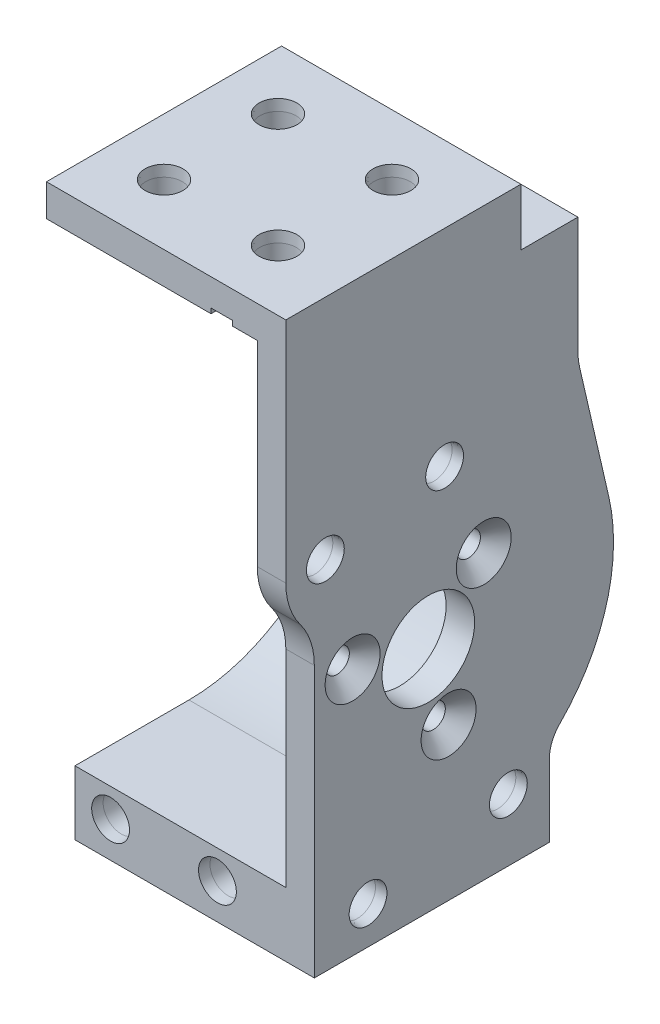
from build123d import *

# Parameters (mm, degrees)
MOTOR_SHELL_DEPTH                   = 33.6
MOTOR_MOUNT_DEPTH                   = 4
MOUNTING_HOLE_D                     = 3.4
MOUNTING_HOLE_CSINK_D               = 7.72
MOUNTING_HOLE_CSINK_ANGLE           = 90
HOLE_DUPLICATION_COUNT              = 3
SKETCH11_R                          = 6.5
SHAFT_BASE_CUTOUT_DEPTH             = 66.612193989
CSK_FOR_M3_INSERT_SFHCS1_AT_2_COUNT = 2
CSK_FOR_M3_INSERT_SFHCS1_AT_2_PITCH = 20
CSK_FOR_M3_INSERT_SFHCS1_AT_3_COUNT = 2
CSK_FOR_M3_INSERT_SFHCS1_AT_3_PITCH = 45.233529346
CSK_FOR_M3_INSERT_SFHCS1_AT_4_COUNT = 2
CSK_FOR_M3_INSERT_SFHCS1_AT_4_PITCH = 48.980637063
CSK_FOR_M3_INSERT_SFHCS2_AT_2_COUNT = 2
CSK_FOR_M3_INSERT_SFHCS2_AT_2_PITCH = 16
CSK_FOR_M3_INSERT_SFHCS2_AT_3_COUNT = 2
CSK_FOR_M3_INSERT_SFHCS2_AT_3_PITCH = 22.627416998
CSK_FOR_M3_INSERT_SFHCS2_AT_4_COUNT = 2
CSK_FOR_M3_INSERT_SFHCS2_AT_4_PITCH = 16
CSK_FOR_M3_INSERT_SFHCS3_AT_2_COUNT = 2
CSK_FOR_M3_INSERT_SFHCS3_AT_2_PITCH = 15
ENLARGE_CAVITY_DEPTH                = 29.6
MOD_1_DEPTH                         = 29.6
SKETCH31_W                          = 8
SKETCH31_H                          = 8
MOD_2_DEPTH                         = 33.6
SKETCH36_W                          = 3
SKETCH36_H                          = 0.7
CUT_EXTRUDE1_DEPTH                  = 23
M4_CLEARANCE_HOLE1_D                = 4.5
M4_CLEARANCE_HOLE1_DEPTH            = 6
M4_CLEARANCE_HOLE1_TIP              = 1.351936393
INSERT_START                        = 45.5
INSERT_CLEARANCES_OUTLINE_R         = 1.8
INSERT_CLEARANCES_DEPTH             = 0.7
INSERT_START_2                      = 29.6
INSERT_CLEARANCES_2_OUTLINE_R       = 1.8
INSERT_CLEARANCES_2_DEPTH           = 0.2
INSERT_CLEARANCES_5_OUTLINE_W       = 1.724765775
INSERT_CLEARANCES_5_OUTLINE_H       = 2.045205283
INSERT_CLEARANCES_8_OUTLINE_W       = 1.724765775
INSERT_CLEARANCES_8_OUTLINE_H       = 2.045205283
FILLET1_R                           = 10


# Read off the part's stored shape, not the designer's step: Insert clearances
with BuildPart() as part:
    # Motor Shell Profile → Motor Shell (new body)
    with BuildSketch(Plane(origin=(0, 0, 0), x_dir=(0, 0, -1), z_dir=(1, 0, 0))):
        with BuildLine():
            Line((25.336282685, 5.837189366), (21.25527589, 23.550772962))
            ThreePointArc((21.25527589, 23.550772962), (21.064023926, 24.66607615), (21, 25.795845795))
            Line((21, 25.795845795), (21, 50))
            Line((21, 50), (-20, 50))
            Line((-20, 50), (-20, 45.5))
            Line((-20, 45.5), (10.9, 45.5))
            ThreePointArc((10.9, 45.5), (12.314213562, 44.914213562), (12.9, 43.5))
            Line((12.9, 43.5), (12.9, 42))
            Line((12.9, 42), (21.438393041, 4.939160233))
            ThreePointArc((21.438393041, 4.939160233), (17.214260442, -13.699242221), (0, -22))
            Line((0, -22), (-16, -22))
            Line((-16, -22), (-16, -32))
            Line((-16, -32), (17, -32))
            Line((17, -32), (17, -21.840329668))
            ThreePointArc((17, -21.840329668), (17.377125597, -19.935327763), (18.451612903, -18.31769585))
            ThreePointArc((18.451612903, -18.31769585), (25.004191048, -7.126740491), (25.336282685, 5.837189366))
        make_face()
    extrude(amount=MOTOR_SHELL_DEPTH)

    # Sketch3 → Motor Mount (add)
    with BuildSketch(Plane(origin=(29.6, 0, 0), x_dir=(0, 0, -1), z_dir=(1, 0, 0))):
        with BuildLine():
            Line((-20, 45.5), (12.9, 45.5))
            Line((12.9, 45.5), (12.9, 42))
            Line((12.9, 42), (21.438393041, 4.939160233))
            ThreePointArc((21.438393041, 4.939160233), (17.214260442, -13.699242221), (0, -22))
            Line((0, -22), (-16, -22))
            Line((-16, -22), (-16, 6))
            ThreePointArc((-16, 6), (-16.513167019, 9.16227766), (-18, 12))
            ThreePointArc((-18, 12), (-19.486832981, 14.83772234), (-20, 18))
            Line((-20, 18), (-20, 45.5))
        make_face()
    extrude(amount=MOTOR_MOUNT_DEPTH)

    # Mounting Hole (through all)
    with Locations(Plane(origin=(33.6, 0, 0), x_dir=(0, 0, -1), z_dir=(1, 0, 0))):
        with Locations((2.847009496, -10.625184089)):
            mounting_hole = CounterSinkHole(MOUNTING_HOLE_D / 2, MOUNTING_HOLE_CSINK_D / 2, counter_sink_angle=MOUNTING_HOLE_CSINK_ANGLE)

    # Hole Duplication: Mounting Hole ×3 about axis
    hole_duplication_axis = Axis((0, 0, 0), (1, 0, 0))
    for i in range(1, HOLE_DUPLICATION_COUNT):
        add(mounting_hole.rotate(hole_duplication_axis, i * 360 / HOLE_DUPLICATION_COUNT), mode=Mode.SUBTRACT)

    # Sketch11 → Shaft Base Cutout (cut, through all)
    with BuildSketch(Plane(origin=(33.6, 0, 0), x_dir=(0, 0, -1), z_dir=(1, 0, 0))):
        Circle(SKETCH11_R)
    extrude(amount=-SHAFT_BASE_CUTOUT_DEPTH, mode=Mode.SUBTRACT)

    # Sketch15 → CSK for M3 Insert SFHCS1 (revolve, cut)
    with BuildSketch(Plane(origin=(33.6, -26.736481777, 8.458892109), x_dir=(0, 0, -1), z_dir=(0, 1, 0))):
        Polygon((0, 0), (0, 3.8), (2.55, 3.8), (2.55, 1.501569957), (2.655, 0), align=None)
    csk_for_m3_insert_sfhcs1 = revolve(axis=Axis((39.95, -26.736481777, 8.458892109), (-1, 0, 0)), mode=Mode.SUBTRACT)

    # CSK for M3 Insert SFHCS1 at 2: CSK for M3 Insert SFHCS1 ×2
    with Locations(*[Vector(0, 0.17364817766693078, -0.984807753012208) * (i * CSK_FOR_M3_INSERT_SFHCS1_AT_2_PITCH) for i in range(1, CSK_FOR_M3_INSERT_SFHCS1_AT_2_COUNT)]):
        add(csk_for_m3_insert_sfhcs1, mode=Mode.SUBTRACT)

    # CSK for M3 Insert SFHCS1 at 3: CSK for M3 Insert SFHCS1 ×2
    with Locations(*[Vector(0, 0.9911835262254977, 0.13249610310944374) * (i * CSK_FOR_M3_INSERT_SFHCS1_AT_3_PITCH) for i in range(1, CSK_FOR_M3_INSERT_SFHCS1_AT_3_COUNT)]):
        add(csk_for_m3_insert_sfhcs1, mode=Mode.SUBTRACT)

    # CSK for M3 Insert SFHCS1 at 4: CSK for M3 Insert SFHCS1 ×2
    with Locations(*[Vector(0, 0.975625288008145, -0.219443153001009) * (i * CSK_FOR_M3_INSERT_SFHCS1_AT_4_PITCH) for i in range(1, CSK_FOR_M3_INSERT_SFHCS1_AT_4_COUNT)]):
        add(csk_for_m3_insert_sfhcs1, mode=Mode.SUBTRACT)

    # Sketch18 → CSK for M3 Insert SFHCS2 (revolve, cut)
    with BuildSketch(Plane(origin=(8, 50, -4.5), x_dir=(0, 0, 1), z_dir=(1, 0, 0))):
        Polygon((0, 0), (0, 3.8), (2.55, 3.8), (2.55, 1.501569957), (2.655, 0), align=None)
    csk_for_m3_insert_sfhcs2 = revolve(axis=Axis((8, 56.35, -4.5), (0, -1, 0)), mode=Mode.SUBTRACT)

    # CSK for M3 Insert SFHCS2 at 2: CSK for M3 Insert SFHCS2 ×2
    with Locations(*[(0, 0, i * CSK_FOR_M3_INSERT_SFHCS2_AT_2_PITCH) for i in range(1, CSK_FOR_M3_INSERT_SFHCS2_AT_2_COUNT)]):
        add(csk_for_m3_insert_sfhcs2, mode=Mode.SUBTRACT)

    # CSK for M3 Insert SFHCS2 at 3: CSK for M3 Insert SFHCS2 ×2
    with Locations(*[Vector(0.7071067811865475, 0, 0.7071067811865476) * (i * CSK_FOR_M3_INSERT_SFHCS2_AT_3_PITCH) for i in range(1, CSK_FOR_M3_INSERT_SFHCS2_AT_3_COUNT)]):
        add(csk_for_m3_insert_sfhcs2, mode=Mode.SUBTRACT)

    # CSK for M3 Insert SFHCS2 at 4: CSK for M3 Insert SFHCS2 ×2
    with Locations(*[(i * CSK_FOR_M3_INSERT_SFHCS2_AT_4_PITCH, 0, 0) for i in range(1, CSK_FOR_M3_INSERT_SFHCS2_AT_4_COUNT)]):
        add(csk_for_m3_insert_sfhcs2, mode=Mode.SUBTRACT)

    # Sketch24 → CSK for M3 Insert SFHCS3 (revolve, cut)
    with BuildSketch(Plane(origin=(5, -27, 16), x_dir=(0, -1, 0), z_dir=(1, 0, 0))):
        Polygon((0, 0), (0, 3.8), (2.55, 3.8), (2.55, 1.501569957), (2.655, 0), align=None)
    csk_for_m3_insert_sfhcs3 = revolve(axis=Axis((5, -27, 22.35), (0, 0, -1)), mode=Mode.SUBTRACT)

    # CSK for M3 Insert SFHCS3 at 2: CSK for M3 Insert SFHCS3 ×2
    with Locations(*[(i * CSK_FOR_M3_INSERT_SFHCS3_AT_2_PITCH, 0, 0) for i in range(1, CSK_FOR_M3_INSERT_SFHCS3_AT_2_COUNT)]):
        add(csk_for_m3_insert_sfhcs3, mode=Mode.SUBTRACT)

    # Sketch29 → Enlarge Cavity (cut)
    with BuildSketch(Plane.ZY):
        with BuildLine():
            Line((0, -23), (16, -23))
            Line((16, -23), (16, 6))
            ThreePointArc((16, 6), (16.513167019, 9.16227766), (18, 12))
            ThreePointArc((18, 12), (19.486832981, 14.83772234), (20, 18))
            Line((20, 18), (20, 45.5))
            Line((20, 45.5), (-11.926196318, 45.5))
            ThreePointArc((-11.926196318, 45.5), (-13.34040988, 44.914213562), (-13.926196318, 43.5))
            Line((-13.926196318, 43.5), (-13.926196318, 42))
            Line((-13.926196318, 42), (-22.412865452, 5.163667516))
            ThreePointArc((-22.412865452, 5.163667516), (-17.996726826, -14.32193505), (0, -23))
        make_face()
    extrude(amount=-ENLARGE_CAVITY_DEPTH, mode=Mode.SUBTRACT)

    # Sketch30 → Mod 1 (add)
    with BuildSketch(Plane.ZY):
        with BuildLine():
            Line((-3.232846165, 45.5), (-11.926196318, 45.5))
            ThreePointArc((-11.926196318, 45.5), (-13.34040988, 44.914213562), (-13.926196318, 43.5))
            Line((-13.926196318, 43.5), (-13.926196318, 42))
            Line((-13.926196318, 42), (-17.266830256, 27.5))
            ThreePointArc((-17.266830256, 27.5), (-13.995261355, 35.311241294), (-8.303590508, 41.582089451))
            ThreePointArc((-8.303590508, 41.582089451), (-7.45571726, 42.303193419), (-6.839374, 43.230016467))
            ThreePointArc((-6.839374, 43.230016467), (-5.363566012, 44.88526704), (-3.232846165, 45.5))
        make_face()
    extrude(amount=-MOD_1_DEPTH)

    # Sketch31 → Mod 2 (cut)
    with BuildSketch(Plane.ZY):
        with Locations((-17, 46)):
            Rectangle(SKETCH31_W, SKETCH31_H)
    extrude(amount=-MOD_2_DEPTH, mode=Mode.SUBTRACT)

    # Sketch33 → CSK for M3 Insert SFHCS4 (revolve, cut)
    with BuildSketch(Plane(origin=(17.5, 45.5, -13), x_dir=(0, 1, 0), z_dir=(1, 0, 0))):
        Polygon((0, 0), (0, 3.8), (2.55, 3.8), (2.55, 1.501569957), (2.655, 0), align=None)
    revolve(axis=Axis((17.5, 45.5, -19.35), (0, 0, 1)), mode=Mode.SUBTRACT)

    # Sketch36 → Cut-Extrude1 (cut)
    with BuildSketch(Plane.XY.offset(20)):
        with Locations((24.6, 45.85)):
            Rectangle(SKETCH36_W, SKETCH36_H)
    extrude(amount=-CUT_EXTRUDE1_DEPTH, mode=Mode.SUBTRACT)

    # M4 Clearance Hole1
    with Locations(Plane(origin=(0, -32, 0), x_dir=(-1, 0, 0), z_dir=(0, -1, 0))):
        with Locations((-8.5, 9.5)):
            Hole(M4_CLEARANCE_HOLE1_D / 2, depth=M4_CLEARANCE_HOLE1_DEPTH)
            with Locations((0, 0, -(M4_CLEARANCE_HOLE1_DEPTH + M4_CLEARANCE_HOLE1_TIP / 2))):  # 118° drill point
                Cone(0, M4_CLEARANCE_HOLE1_D / 2, M4_CLEARANCE_HOLE1_TIP, mode=Mode.SUBTRACT)

    # Sketch40 → CSK for M3 Insert SFHCS5 (revolve, cut)
    with BuildSketch(Plane(origin=(6, 31.795845795, -21), x_dir=(0, 1, 0), z_dir=(1, 0, 0))):
        Polygon((0, 0), (0, 3.8), (2.55, 3.8), (2.55, 1.501569957), (2.655, 0), align=None)
    revolve(axis=Axis((6, 31.795845795, -27.35), (0, 0, 1)), mode=Mode.SUBTRACT)

    # Insert clearances outline → Insert clearances (cut)
    with BuildSketch(Plane(origin=(0, 0, 0), x_dir=(1, 0, 0), z_dir=(0, 1, 0)).offset(INSERT_START)):
        with Locations((8, -11.5)):
            Circle(INSERT_CLEARANCES_OUTLINE_R)
        with BuildLine():
            Line((23.1, -13.058845727), (23.1, -9.941154273))
            ThreePointArc((23.1, -9.941154273), (22.2, -11.5), (23.1, -13.058845727))
        make_face()
        with BuildLine():
            ThreePointArc((24.994987437, 3), (23.944130883, 6.299132747), (23.1, 2.941154273))
            Line((23.1, 2.941154273), (23.1, 3))
            Line((23.1, 3), (24.994987437, 3))
        make_face()
        with Locations((8, 4.5)):
            Circle(INSERT_CLEARANCES_OUTLINE_R)
    extrude(amount=INSERT_CLEARANCES_DEPTH, mode=Mode.SUBTRACT)

    # Insert clearances 2 outline → Insert clearances 2 (cut)
    with BuildSketch(Plane.YZ.offset(INSERT_START_2)):
        with Locations((18.098247344, 14.452158477)):
            Circle(INSERT_CLEARANCES_2_OUTLINE_R)
        with Locations((21.050266364, -2.289573324)):
            Circle(INSERT_CLEARANCES_2_OUTLINE_R)
    extrude(amount=INSERT_CLEARANCES_2_DEPTH, mode=Mode.SUBTRACT)

    # Insert clearances 3 outline → Insert clearances 3 (revolve, cut)
    with BuildSketch(Plane(origin=(20, -27, 0), x_dir=(1, 0, 0), z_dir=(0, -1, 0))):
        Polygon((0, 12.2), (0, 9.118450886), (1.8, 10.2), (1.8, 12.2), align=None)
    revolve(axis=Axis((20, -27, 0), (0, 0, 1)), mode=Mode.SUBTRACT)

    # Insert clearances 4 outline → Insert clearances 4 (revolve, cut)
    with BuildSketch(Plane(origin=(5, -27, 0), x_dir=(1, 0, 0), z_dir=(0, -1, 0))):
        Polygon((0, 12.2), (0, 9.118450886), (1.8, 10.2), (1.8, 12.2), align=None)
    revolve(axis=Axis((5, -27, 0), (0, 0, 1)), mode=Mode.SUBTRACT)

    # Insert clearances 5 outline → Insert clearances 5 (revolve, cut)
    with BuildSketch(Plane(origin=(8, 0, -4.5), x_dir=(1, 0, 0), z_dir=(0, 0, 1))):
        Polygon((1.724765775, 46.2), (1.724765775, 44.154794717), (1.800001136, 44.200000683), (1.8, 46.2), align=None)
        with Locations((0.862382888, 45.177397359)):
            Rectangle(INSERT_CLEARANCES_5_OUTLINE_W, INSERT_CLEARANCES_5_OUTLINE_H)
    revolve(axis=Axis((8, 0, -4.5), (0, 1, 0)), mode=Mode.SUBTRACT)

    # Insert clearances 6 outline → Insert clearances 6 (revolve, cut)
    with BuildSketch(Plane(origin=(17.5, 45.5, 0), x_dir=(1, 0, 0), z_dir=(0, -1, 0))):
        Polygon((1.8, -7.2), (0, -6.118450886), (0, -9.2), (1.8, -9.2), align=None)
    revolve(axis=Axis((17.5, 45.5, 0), (0, 0, 1)), mode=Mode.SUBTRACT)

    # Insert clearances 7 outline → Insert clearances 7 (revolve, cut)
    with BuildSketch(Plane(origin=(6, 31.795845795, 0), x_dir=(1, 0, 0), z_dir=(0, -1, 0))):
        Polygon((0, -17.2), (1.8, -17.2), (1.8, -15.2), (1.616604169, -15.089804668), (0, -15.089804668), align=None)
    revolve(axis=Axis((6, 31.795845795, 0), (0, 0, 1)), mode=Mode.SUBTRACT)

    # Insert clearances 8 outline → Insert clearances 8 (revolve, cut)
    with BuildSketch(Plane(origin=(24, 0, -4.5), x_dir=(1, 0, 0), z_dir=(0, 0, 1))):
        Polygon((1.724765775, 44.154794717), (1.800001136, 44.200000683), (1.8, 46.2), (1.724765775, 46.2), align=None)
        with Locations((0.862382888, 45.177397359)):
            Rectangle(INSERT_CLEARANCES_8_OUTLINE_W, INSERT_CLEARANCES_8_OUTLINE_H)
    revolve(axis=Axis((24, 0, -4.5), (0, 1, 0)), mode=Mode.SUBTRACT)

    # Insert clearances 9 outline → Insert clearances 9 (revolve, cut)
    with BuildSketch(Plane(origin=(0, -23.263518223, -11.237262951), x_dir=(0, 1, 0), z_dir=(0, 0, -1))):
        Polygon((0, 29.8), (0, 26.718450886), (1.8, 27.8), (1.8, 29.8), align=None)
    revolve(axis=Axis((0, -23.263518223, -11.237262951), (1, 0, 0)), mode=Mode.SUBTRACT)

    # Insert clearances 10 outline → Insert clearances 10 (revolve, cut)
    with BuildSketch(Plane(origin=(0, -26.736481777, 8.458892109), x_dir=(0, 1, 0), z_dir=(0, 0, -1))):
        Polygon((0, 29.8), (0, 26.718450886), (1.8, 27.8), (1.8, 29.8), align=None)
    revolve(axis=Axis((0, -26.736481777, 8.458892109), (1, 0, 0)), mode=Mode.SUBTRACT)

    # Fillet1
    # the kernel refuses this fillet: 10 mm, written as the material it takes off along each edge
    with BuildSketch(Plane(origin=(24.994989492, 40.864768522, -3), x_dir=(0.42962057517036795, 0, -0.9030095023809451), z_dir=(0, 1, 0))) as fillet1_piece_1:
        with BuildLine():
            CenterArc((7.004346539, -8.571749196), FILLET1_R, 120.999152423, 9.766079725)
            Line((0.47473525, -0.997834989), (0, 0))
            ThreePointArc((0, 0), (0.927046296, -0.257085307), (1.854092591, 0))
        make_face()
    extrude(amount=5.335231478, mode=Mode.SUBTRACT)


solid = part.part
